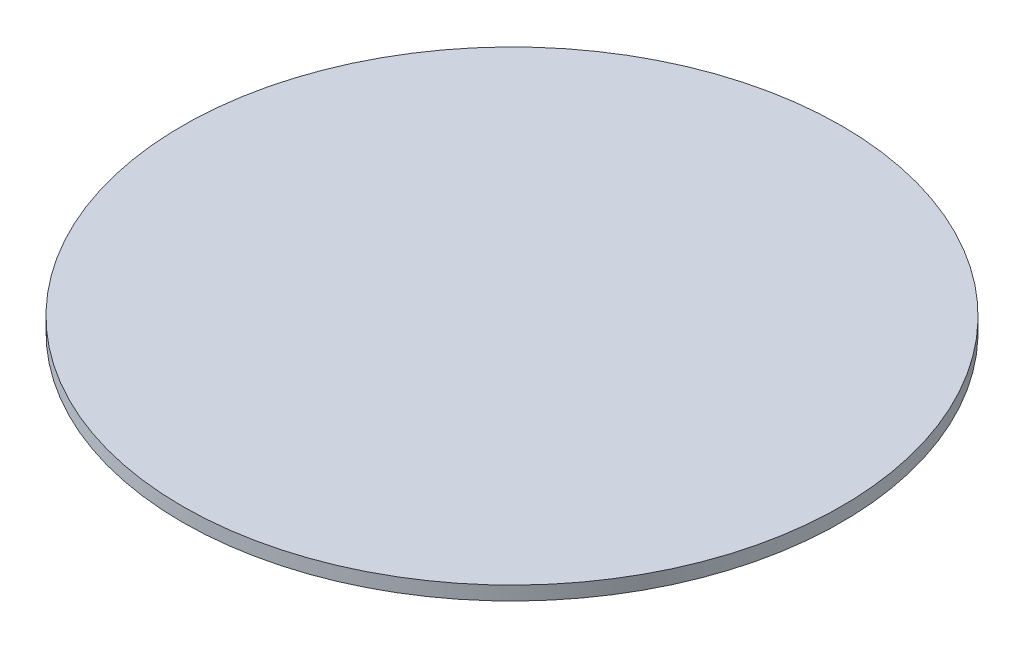
from build123d import *

# Parameters (mm, degrees)
SKETCH1_R           = 2385
BOSS_EXTRUDE1_DEPTH = 100


with BuildPart() as part:
    # Sketch1 → Boss-Extrude1 (new body)
    with BuildSketch(Plane(origin=(0, 0, 0), x_dir=(1, 0, 0), z_dir=(0, 1, 0))):
        Circle(SKETCH1_R)
    extrude(amount=BOSS_EXTRUDE1_DEPTH)


solid = part.part
